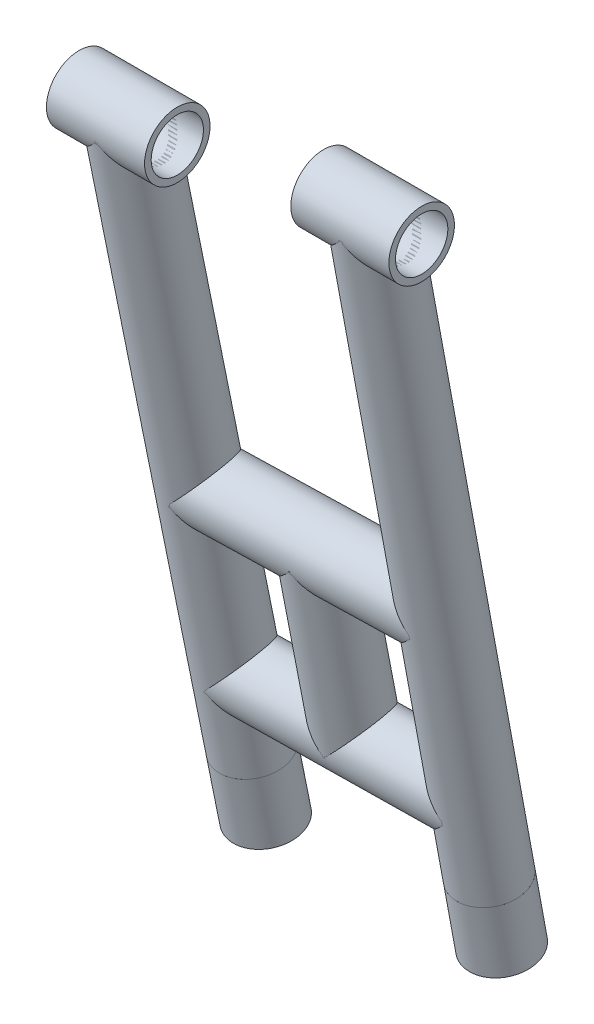
from build123d import *

# Parameters (mm, degrees)
SKETCH112_R              = 16.7005
SKETCH112_R_2            = 13.322299999999998
PIPE_1_0_SCH_40_74_DEPTH = 328.674612384
SKETCH113_R              = 16.7005
SKETCH113_R_2            = 13.322299999999998
PIPE_1_0_SCH_40_75_DEPTH = 315
SKETCH114_R              = 16.7005
SKETCH114_R_2            = 13.322299999999998
PIPE_1_0_SCH_40_76_DEPTH = 35
SKETCH115_R              = 16.7005
SKETCH115_R_2            = 13.322299999999998
PIPE_1_0_SCH_40_77_DEPTH = 35
SKETCH116_R              = 16.7005
SKETCH116_R_2            = 13.322299999999998
PIPE_1_0_SCH_40_78_DEPTH = 92.875256958
SKETCH117_R              = 16.7005
SKETCH117_R_2            = 13.322299999999998
PIPE_1_0_SCH_40_79_DEPTH = 121.982937829
SKETCH118_R              = 16.7005
SKETCH118_R_2            = 13.322299999999998
PIPE_1_0_SCH_40_80_DEPTH = 121.124788874
SKETCH119_R              = 16.7005
SKETCH119_R_2            = 13.322299999999998
PIPE_1_0_SCH_40_81_DEPTH = 50
SKETCH120_R              = 16.7005
SKETCH120_R_2            = 13.322299999999998
PIPE_1_0_SCH_40_82_DEPTH = 50
TRIM_EXTEND8_START       = 3295
TRIM_EXTEND8_DEPTH       = 35
TRIM_EXTEND8_START_2     = 3172.299598239
TRIM_EXTEND8_2_DEPTH     = 34.700401761


with BuildPart() as part:
    # Sketch112 → Pipe 1.0 SCH 40(74) (new body)
    with BuildSketch(Plane(origin=(3312.7000000000007, -233.7700000000001, 340.6), x_dir=(0.9999606735808455, -0.006830528434614999, 0.005656427586899527), z_dir=(-0.005656427586899527, -0.982453788095669, -0.18642038269305414))):
        Circle(SKETCH112_R)
        Circle(SKETCH112_R_2, mode=Mode.SUBTRACT)
    extrude(amount=PIPE_1_0_SCH_40_74_DEPTH)

    # Trim/Extend8: read off the stored shape, not the designer's step
    # Trim/Extend8 outline → Trim/Extend8 (cut)
    with BuildSketch(Plane.YZ.offset(TRIM_EXTEND8_START)):
        with BuildLine():
            Line((-230, 354.847813303), (-236.19759771, 353.699253668))
            ThreePointArc((-236.19759771, 353.699253668), (-246.858753491, 338.116412005), (-231.230467129, 327.521986004))
            Line((-231.230467129, 327.521986004), (-230, 327.760922262))
            Line((-230, 327.760922262), (-230, 354.847813303))
        make_face()
    extrude(amount=TRIM_EXTEND8_DEPTH, mode=Mode.SUBTRACT)


with BuildPart() as body_2:
    # Sketch113 → Pipe 1.0 SCH 40(75) (new body)
    with BuildSketch(Plane(origin=(3189, -251.4400000000004, 341.45000000000005), x_dir=(0.9999853555123668, 0.00418616986198941, -0.0034299770687399693), z_dir=(0.0034299770687399684, -0.9804690332667881, -0.19664361180114104))):
        Circle(SKETCH113_R)
        Circle(SKETCH113_R_2, mode=Mode.SUBTRACT)
    extrude(amount=PIPE_1_0_SCH_40_75_DEPTH)

    # Trim_Extend8 2 outline → Trim_Extend8 2 (cut)
    with BuildSketch(Plane.YZ.offset(TRIM_EXTEND8_START_2)):
        with BuildLine():
            ThreePointArc((-254.025883097, 354.518928261), (-254.042824036, 354.51556483), (-254.0597606, 354.512179438))
            ThreePointArc((-254.0597606, 354.512179438), (-264.502179439, 338.8302394), (-248.8202394, 328.387820561))
            ThreePointArc((-248.8202394, 328.387820561), (-248.803307239, 328.391227908), (-248.78637951, 328.394657202))
            Line((-248.78637951, 328.394657202), (-247, 328.75775554))
            Line((-247, 328.75775554), (-247, 355.909104408))
            Line((-247, 355.909104408), (-254.025883097, 354.518928261))
        make_face()
    extrude(amount=TRIM_EXTEND8_2_DEPTH, mode=Mode.SUBTRACT)


with BuildPart() as body_3:
    # Sketch114 → Pipe 1.0 SCH 40(76) (new body)
    with BuildSketch(Plane(origin=(3310.8408758553996, -556.6776179872779, 279.32835297793275), x_dir=(0.9999606735808453, -0.006830528434635592, 0.005656427586916585), z_dir=(-0.005656427586916585, -0.982453788095669, -0.18642038269305322))):
        Circle(SKETCH114_R)
        Circle(SKETCH114_R_2, mode=Mode.SUBTRACT)
    extrude(amount=PIPE_1_0_SCH_40_76_DEPTH)


with BuildPart() as body_4:
    # Sketch115 → Pipe 1.0 SCH 40(77) (new body)
    with BuildSketch(Plane(origin=(3190.0804427766534, -560.2877454790384, 279.50726228264085), x_dir=(0.9999853555123668, 0.0041861698619945695, -0.003429977068744201), z_dir=(0.0034299770687442003, -0.9804690332667884, -0.19664361180113965))):
        Circle(SKETCH115_R)
        Circle(SKETCH115_R_2, mode=Mode.SUBTRACT)
    extrude(amount=PIPE_1_0_SCH_40_77_DEPTH)


with BuildPart() as body_5:
    # Sketch116 → Pipe 1.0 SCH 40(78) (new body)
    with BuildSketch(Plane(origin=(3250.497757270625, -519.5585049211952, 287.0220897411603), x_dir=(0.999998956997144, -0.000918275771341961, -0.0011147978435796801), z_dir=(0.0011147978435796803, 0.9814851836182317, 0.19153483120219758))):
        Circle(SKETCH116_R)
        Circle(SKETCH116_R_2, mode=Mode.SUBTRACT)
    extrude(amount=PIPE_1_0_SCH_40_78_DEPTH)


with BuildPart() as body_6:
    # Sketch117 → Pipe 1.0 SCH 40(79) (new body)
    with BuildSketch(Plane(origin=(3311.5819667652445, -427.9589947019016, 303.7526824510725), x_dir=(0.017402900528125254, -0.00715141028598659, 0.9998229825244715), z_dir=(-0.9998229825244717, -0.00727678146539853, 0.017350852064817148))):
        Circle(SKETCH117_R)
        Circle(SKETCH117_R_2, mode=Mode.SUBTRACT)
    extrude(amount=PIPE_1_0_SCH_40_79_DEPTH)


with BuildPart() as body_7:
    # Sketch118 → Pipe 1.0 SCH 40(80) (new body)
    with BuildSketch(Plane(origin=(3311.0564332872736, -519.2378713903695, 286.4325363737292), x_dir=(0.00976240334033433, -0.005242904862811175, 0.9999386018299424), z_dir=(-0.9999386018299424, -0.005294267735068268, 0.009734644293926464))):
        Circle(SKETCH118_R)
        Circle(SKETCH118_R_2, mode=Mode.SUBTRACT)
    extrude(amount=PIPE_1_0_SCH_40_80_DEPTH)


with BuildPart() as body_8:
    # Sketch119 → Pipe 1.0 SCH 40(81) (new body)
    with BuildSketch(Plane(origin=(3337.7000000000003, -233.77000000000004, 340.6), x_dir=(0, 0, 1), z_dir=(-1, 0, 0))):
        Circle(SKETCH119_R)
        Circle(SKETCH119_R_2, mode=Mode.SUBTRACT)
    extrude(amount=PIPE_1_0_SCH_40_81_DEPTH)


with BuildPart() as body_9:
    # Sketch120 → Pipe 1.0 SCH 40(82) (new body)
    with BuildSketch(Plane(origin=(3214, -251.44000000000034, 341.45000000000005), x_dir=(0, 0, 1), z_dir=(-1, 0, 0))):
        Circle(SKETCH120_R)
        Circle(SKETCH120_R_2, mode=Mode.SUBTRACT)
    extrude(amount=PIPE_1_0_SCH_40_82_DEPTH)


solid = Compound([part.part, body_2.part, body_3.part, body_4.part, body_5.part, body_6.part, body_7.part, body_8.part, body_9.part])
